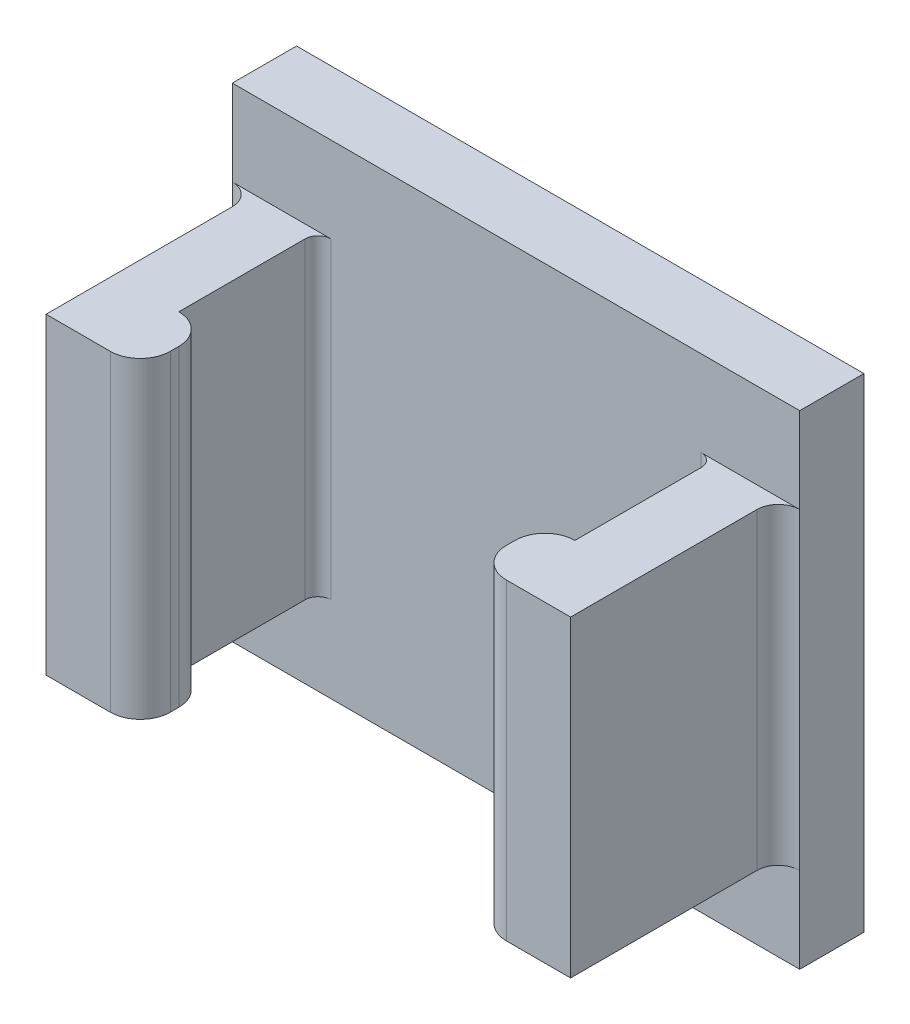
from build123d import *

# Parameters (mm, degrees)
SKETCH_1_W          = 12.25
SKETCH_1_H          = 11.3
EXTRUDE_1_DEPTH     = 2.5
SKETCH_2_W          = 1.5
SKETCH_2_H          = 11.3
EXTRUDE_2_DEPTH     = 3.85
SKETCH_5_W          = 9.25
SKETCH_5_H          = 11.5
CUT_EXTRUDE_1_DEPTH = 1
SKETCH_8_W          = 1.6
SKETCH_8_H          = 11.3
EXTRUDE_5_DEPTH     = 0.7
SKETCH_9_W          = 1.6
SKETCH_9_H          = 11.3
EXTRUDE_6_DEPTH     = 0.7
FILLET_8_R          = 0.3
SKETCH_11_W         = 12.25
SKETCH_11_H         = 4.85
CUT_EXTRUDE_2_DEPTH = 2
SKETCH_12_W         = 12.25
SKETCH_12_H         = 4.85
CUT_EXTRUDE_3_DEPTH = 2
SKETCH_13_W         = 1.5
SKETCH_13_H         = 11.3
EXTRUDE_7_DEPTH     = 0.5
SKETCH_14_W         = 1.5
SKETCH_14_H         = 11.3
EXTRUDE_8_DEPTH     = 0.5
FILLET_9_R          = 0.5
FILLET_10_R         = 0.7


with BuildPart() as part:
    # 스케치1 → 보스-돌출1 (new body)
    with BuildSketch(Plane.XY):
        Rectangle(SKETCH_1_W, SKETCH_1_H)
    extrude(amount=EXTRUDE_1_DEPTH)

    # 스케치2 → 보스-돌출2 (add)
    with BuildSketch(Plane.XY.offset(2.5)):
        with Locations((-5.375, 0)):
            Rectangle(SKETCH_2_W, SKETCH_2_H)
        with Locations((5.375, 0)):
            Rectangle(SKETCH_2_W, SKETCH_2_H)
    extrude(amount=EXTRUDE_2_DEPTH)

    # 스케치5 → 컷-돌출1 (cut)
    with BuildSketch(Plane.XY.offset(2.5)):
        Rectangle(SKETCH_5_W, SKETCH_5_H)
    extrude(amount=-CUT_EXTRUDE_1_DEPTH, mode=Mode.SUBTRACT)

    # 스케치8 → 보스-돌출5 (add)
    with BuildSketch(Plane(origin=(-4.625, 0, 0), x_dir=(0, 0, -1), z_dir=(1, 0, 0))):
        with Locations((-5.55, 0)):
            Rectangle(SKETCH_8_W, SKETCH_8_H)
    extrude(amount=EXTRUDE_5_DEPTH)

    # 스케치9 → 보스-돌출6 (add)
    with BuildSketch(Plane.ZY.offset(-4.625)):
        with Locations((5.55, 0)):
            Rectangle(SKETCH_9_W, SKETCH_9_H)
    extrude(amount=EXTRUDE_6_DEPTH)

    # 필렛8
    fillet_8_edges = [part.edges().sort_by_distance(p)[0] for p in [
        (4.625, 0, 1.5),
        (-4.625, 0, 1.5),
    ]]
    fillet(fillet_8_edges, radius=FILLET_8_R)

    # 스케치11 → 컷-돌출2 (cut)
    with BuildSketch(Plane(origin=(0, 5.65, 0), x_dir=(1, 0, 0), z_dir=(0, 1, 0))):
        with Locations((0, -3.925)):
            Rectangle(SKETCH_11_W, SKETCH_11_H)
    extrude(amount=-CUT_EXTRUDE_2_DEPTH, mode=Mode.SUBTRACT)

    # 스케치12 → 컷-돌출3 (cut)
    with BuildSketch(Plane.XZ.offset(5.65)):
        with Locations((0, 3.925)):
            Rectangle(SKETCH_12_W, SKETCH_12_H)
    extrude(amount=-CUT_EXTRUDE_3_DEPTH, mode=Mode.SUBTRACT)

    # 스케치13 → 보스-돌출7 (add)
    with BuildSketch(Plane(origin=(6.125, 0, 0), x_dir=(0, 0, -1), z_dir=(1, 0, 0))):
        with Locations((-0.75, 0)):
            Rectangle(SKETCH_13_W, SKETCH_13_H)
    extrude(amount=EXTRUDE_7_DEPTH)

    # 스케치14 → 보스-돌출8 (add)
    with BuildSketch(Plane.ZY.offset(6.125)):
        with Locations((0.75, 0)):
            Rectangle(SKETCH_14_W, SKETCH_14_H)
    extrude(amount=EXTRUDE_8_DEPTH)

    # 필렛9
    fillet_9_edges = [part.edges().sort_by_distance(p)[0] for p in [
        (6.125, 0, 1.5),
        (-6.125, 0, 1.5),
    ]]
    fillet(fillet_9_edges, radius=FILLET_9_R - 0.0001)  # a hair under: the kernel refuses the full size

    # 필렛10
    fillet_10_edges = [part.edges().sort_by_distance(p)[0] for p in [
        (-3.925, 0, 6.35),
        (-3.925, 0, 4.75),
        (3.925, 0, 4.75),
        (3.925, 0, 6.35),
    ]]
    fillet(fillet_10_edges, radius=FILLET_10_R - 0.0001)  # a hair under: the kernel refuses the full size


solid = part.part
